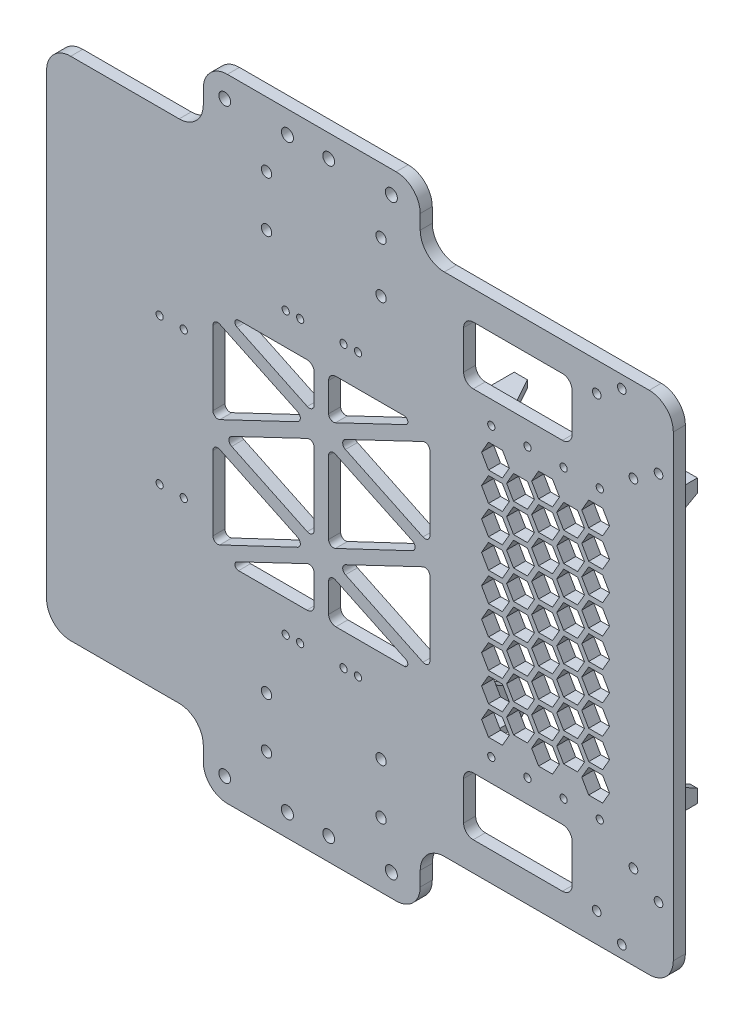
from build123d import *

# Parameters (mm, degrees)
EXTRUDE_1_DEPTH       = 5
EXTRUDE_2_DEPTH       = 20
CUT_EXTRUDE_3_DEPTH   = 10
CUT_EXTRUDE_4_DEPTH   = 10
MIRROR_2_COPY_1_DEPTH = 20
MIRROR_2_COPY_2_DEPTH = 10
MIRROR_2_COPY_3_DEPTH = 10
MIRROR_2_COPY_4_DEPTH = 20
MIRROR_2_COPY_5_DEPTH = 10
MIRROR_2_COPY_6_DEPTH = 10
CUT_EXTRUDE_5_DEPTH   = 5
SKETCH_9_W            = 45
SKETCH_9_H            = 24
CUT_EXTRUDE_6_DEPTH   = 5
FILLET_1_R            = 4
FILLET_2_R            = 1.5
FILLET_3_R            = 2
FILLET_4_R            = 3
SKETCH_10_R           = 1.8
SKETCH_10_R_2         = 2.5
SKETCH_10_R_3         = 2.45
SKETCH_10_R_4         = 1.5
SKETCH_10_R_5         = 2.15
CUT_EXTRUDE_7_DEPTH   = 186.636742053


with BuildPart() as part:
    # 草图1 → 凸台-拉伸1 (new body)
    with BuildSketch(Plane.XY):
        with BuildLine():
            Line((-130, 95), (-130, -95))
            ThreePointArc((-130, -95), (-127.071067812, -102.071067812), (-120, -105))
            Line((-120, -105), (-75, -105))
            ThreePointArc((-75, -105), (-67.928932188, -107.928932188), (-65, -115))
            Line((-65, -115), (-65, -121))
            ThreePointArc((-65, -121), (-62.071067812, -128.071067812), (-55, -131))
            Line((-55, -131), (15, -131))
            ThreePointArc((15, -131), (22.071067812, -128.071067812), (25, -121))
            Line((25, -121), (25, -115))
            ThreePointArc((25, -115), (27.928932188, -107.928932188), (35, -105))
            Line((35, -105), (120, -105))
            ThreePointArc((120, -105), (127.071067812, -102.071067812), (130, -95))
            Line((130, -95), (130, 95))
            ThreePointArc((130, 95), (127.071067812, 102.071067812), (120, 105))
            Line((120, 105), (35, 105))
            ThreePointArc((35, 105), (27.928932188, 107.928932188), (25, 115))
            Line((25, 115), (25, 121))
            ThreePointArc((25, 121), (22.071067812, 128.071067812), (15, 131))
            Line((15, 131), (-55, 131))
            ThreePointArc((-55, 131), (-62.071067812, 128.071067812), (-65, 121))
            Line((-65, 121), (-65, 115))
            ThreePointArc((-65, 115), (-67.928932188, 107.928932188), (-75, 105))
            Line((-75, 105), (-120, 105))
            ThreePointArc((-120, 105), (-127.071067812, 102.071067812), (-130, 95))
        make_face()
    extrude(amount=EXTRUDE_1_DEPTH)

    # 草图4 → 凸台-拉伸2 (add)
    with BuildSketch(Plane(origin=(0, 0, 0), x_dir=(-1, 0, 0), z_dir=(0, 0, -1))):
        Polygon((-39, -47.5), (-39, -58.5), (-50, -58.5), (-50, -55.5), (-42, -55.5), (-42, -47.5), align=None)
    extrude_2 = extrude(amount=EXTRUDE_2_DEPTH)

    # 草图5 → 切除-拉伸3 (cut)
    with BuildSketch(Plane.XZ.offset(58.5)):
        Polygon((50, -10), (44.5, -20), (50, -20), align=None)
    cut_extrude_3 = extrude(amount=-CUT_EXTRUDE_3_DEPTH, mode=Mode.SUBTRACT)

    # 草图6 → 切除-拉伸4 (cut)
    with BuildSketch(Plane.ZY.offset(-39)):
        Polygon((-20, -53), (-10, -47.5), (-20, -47.5), align=None)
    cut_extrude_4 = extrude(amount=-CUT_EXTRUDE_4_DEPTH, mode=Mode.SUBTRACT)

    # 镜向1: 凸台-拉伸2, 切除-拉伸3, 切除-拉伸4 across plane
    add(extrude_2.mirror(Plane(origin=(77, 0, 0), x_dir=(0, 0, 1), z_dir=(1, 0, 0))))
    add(cut_extrude_3.mirror(Plane(origin=(77, 0, 0), x_dir=(0, 0, 1), z_dir=(1, 0, 0))), mode=Mode.SUBTRACT)
    add(cut_extrude_4.mirror(Plane(origin=(77, 0, 0), x_dir=(0, 0, 1), z_dir=(1, 0, 0))), mode=Mode.SUBTRACT)

    # 镜向2 copy 1 sketch → 镜向2 copy 1 (add)
    with BuildSketch(Plane(origin=(154, 0, 0), x_dir=(1, 0, 0), z_dir=(0, 0, -1))):
        Polygon((-39, -47.5), (-39, -58.5), (-50, -58.5), (-50, -55.5), (-42, -55.5), (-42, -47.5), align=None)
    extrude(amount=MIRROR_2_COPY_1_DEPTH)

    # 镜向2 copy 2 sketch → 镜向2 copy 2 (cut)
    with BuildSketch(Plane(origin=(154, 58.5, 0), x_dir=(-1, 0, 0), z_dir=(0, 1, 0))):
        Polygon((50, -10), (44.5, -20), (50, -20), align=None)
    extrude(amount=-MIRROR_2_COPY_2_DEPTH, mode=Mode.SUBTRACT)

    # 镜向2 copy 3 sketch → 镜向2 copy 3 (cut)
    with BuildSketch(Plane(origin=(115, 0, 0), x_dir=(0, 0, 1), z_dir=(1, 0, 0))):
        Polygon((-20, -53), (-10, -47.5), (-20, -47.5), align=None)
    extrude(amount=-MIRROR_2_COPY_3_DEPTH, mode=Mode.SUBTRACT)

    # 镜向2 copy 4 sketch → 镜向2 copy 4 (add)
    with BuildSketch(Plane(origin=(0, 0, 0), x_dir=(-1, 0, 0), z_dir=(0, 0, -1))):
        Polygon((-39, 47.5), (-39, 58.5), (-50, 58.5), (-50, 55.5), (-42, 55.5), (-42, 47.5), align=None)
    extrude(amount=MIRROR_2_COPY_4_DEPTH)

    # 镜向2 copy 5 sketch → 镜向2 copy 5 (cut)
    with BuildSketch(Plane(origin=(0, 58.5, 0), x_dir=(1, 0, 0), z_dir=(0, 1, 0))):
        Polygon((50, 10), (44.5, 20), (50, 20), align=None)
    extrude(amount=-MIRROR_2_COPY_5_DEPTH, mode=Mode.SUBTRACT)

    # 镜向2 copy 6 sketch → 镜向2 copy 6 (cut)
    with BuildSketch(Plane.ZY.offset(-39)):
        Polygon((-20, 53), (-10, 47.5), (-20, 47.5), align=None)
    extrude(amount=-MIRROR_2_COPY_6_DEPTH, mode=Mode.SUBTRACT)

    # 草图7 → 切除-拉伸5 (cut)
    with BuildSketch(Plane(origin=(0, 0, 0), x_dir=(-1, 0, 0), z_dir=(0, 0, -1))):
        Polygon((-92.012994616, 36), (-94.899745962, 41), (-100.673248654, 41), (-103.56, 36), (-100.673248654, 31), (-94.899745962, 31), align=None)
        Polygon((-74.115136271, 31), (-71.228384925, 36), (-74.115136271, 41), (-79.888638963, 41), (-82.775390309, 36), (-79.888638963, 31), align=None)
        Polygon((-92.012994616, 24), (-94.899745962, 29), (-100.673248654, 29), (-103.56, 24), (-100.673248654, 19), (-94.899745962, 19), align=None)
        Polygon((-93.167695155, 30), (-90.280943809, 25), (-84.507441117, 25), (-81.620689771, 30), (-84.507441117, 35), (-90.280943809, 35), align=None)
        Polygon((-84.507441117, 37), (-81.620689771, 42), (-84.507441117, 47), (-90.280943809, 47), (-93.167695155, 42), (-90.280943809, 37), align=None)
        Polygon((-79.888638963, 43), (-74.115136271, 43), (-71.228384925, 48), (-74.115136271, 53), (-79.888638963, 53), (-82.775390309, 48), align=None)
        Polygon((-94.899745962, 43), (-92.012994616, 48), (-94.899745962, 53), (-100.673248654, 53), (-103.56, 48), (-100.673248654, 43), align=None)
        Polygon((-72.383085464, 42), (-69.496334118, 37), (-63.722831426, 37), (-60.83608008, 42), (-63.722831426, 47), (-69.496334118, 47), align=None)
        Polygon((-93.167695155, 18), (-90.280943809, 13), (-84.507441117, 13), (-81.620689771, 18), (-84.507441117, 23), (-90.280943809, 23), align=None)
        Polygon((-74.115136271, 19), (-71.228384925, 24), (-74.115136271, 29), (-79.888638963, 29), (-82.775390309, 24), (-79.888638963, 19), align=None)
        Polygon((-72.383085464, 30), (-69.496334118, 25), (-63.722831426, 25), (-60.83608008, 30), (-63.722831426, 35), (-69.496334118, 35), align=None)
        Polygon((-92.012994616, 12), (-94.899745962, 17), (-100.673248654, 17), (-103.56, 12), (-100.673248654, 7), (-94.899745962, 7), align=None)
        Polygon((-93.167695155, 6), (-90.280943809, 1), (-84.507441117, 1), (-81.620689771, 6), (-84.507441117, 11), (-90.280943809, 11), align=None)
        Polygon((-74.115136271, 7), (-71.228384925, 12), (-74.115136271, 17), (-79.888638963, 17), (-82.775390309, 12), (-79.888638963, 7), align=None)
        Polygon((-72.383085464, 18), (-69.496334118, 13), (-63.722831426, 13), (-60.83608008, 18), (-63.722831426, 23), (-69.496334118, 23), align=None)
        Polygon((-92.012994616, 0), (-94.899745962, 5), (-100.673248654, 5), (-103.56, 0), (-100.673248654, -5), (-94.899745962, -5), align=None)
        Polygon((-93.167695155, -6), (-90.280943809, -11), (-84.507441117, -11), (-81.620689771, -6), (-84.507441117, -1), (-90.280943809, -1), align=None)
        Polygon((-74.115136271, -5), (-71.228384925, 0), (-74.115136271, 5), (-79.888638963, 5), (-82.775390309, 0), (-79.888638963, -5), align=None)
        Polygon((-72.383085464, 6), (-69.496334118, 1), (-63.722831426, 1), (-60.83608008, 6), (-63.722831426, 11), (-69.496334118, 11), align=None)
        Polygon((-92.012994616, -12), (-94.899745962, -7), (-100.673248654, -7), (-103.56, -12), (-100.673248654, -17), (-94.899745962, -17), align=None)
        Polygon((-93.167695155, -18), (-90.280943809, -23), (-84.507441117, -23), (-81.620689771, -18), (-84.507441117, -13), (-90.280943809, -13), align=None)
        Polygon((-74.115136271, -17), (-71.228384925, -12), (-74.115136271, -7), (-79.888638963, -7), (-82.775390309, -12), (-79.888638963, -17), align=None)
        Polygon((-72.383085464, -6), (-69.496334118, -11), (-63.722831426, -11), (-60.83608008, -6), (-63.722831426, -1), (-69.496334118, -1), align=None)
        Polygon((-92.012994616, -24), (-94.899745962, -19), (-100.673248654, -19), (-103.56, -24), (-100.673248654, -29), (-94.899745962, -29), align=None)
        Polygon((-93.167695155, -30), (-90.280943809, -35), (-84.507441117, -35), (-81.620689771, -30), (-84.507441117, -25), (-90.280943809, -25), align=None)
        Polygon((-74.115136271, -29), (-71.228384925, -24), (-74.115136271, -19), (-79.888638963, -19), (-82.775390309, -24), (-79.888638963, -29), align=None)
        Polygon((-72.383085464, -18), (-69.496334118, -23), (-63.722831426, -23), (-60.83608008, -18), (-63.722831426, -13), (-69.496334118, -13), align=None)
        Polygon((-92.012994616, -36), (-94.899745962, -31), (-100.673248654, -31), (-103.56, -36), (-100.673248654, -41), (-94.899745962, -41), align=None)
        Polygon((-93.167695155, -42), (-90.280943809, -47), (-84.507441117, -47), (-81.620689771, -42), (-84.507441117, -37), (-90.280943809, -37), align=None)
        Polygon((-74.115136271, -41), (-71.228384925, -36), (-74.115136271, -31), (-79.888638963, -31), (-82.775390309, -36), (-79.888638963, -41), align=None)
        Polygon((-72.383085464, -30), (-69.496334118, -35), (-63.722831426, -35), (-60.83608008, -30), (-63.722831426, -25), (-69.496334118, -25), align=None)
        Polygon((-92.012994616, -48), (-94.899745962, -43), (-100.673248654, -43), (-103.56, -48), (-100.673248654, -53), (-94.899745962, -53), align=None)
        Polygon((-74.115136271, -53), (-71.228384925, -48), (-74.115136271, -43), (-79.888638963, -43), (-82.775390309, -48), (-79.888638963, -53), align=None)
        Polygon((-72.383085464, -42), (-69.496334118, -47), (-63.722831426, -47), (-60.83608008, -42), (-63.722831426, -37), (-69.496334118, -37), align=None)
        Polygon((-61.990780618, 36), (-59.104029272, 31), (-53.330526581, 31), (-50.443775235, 36), (-53.330526581, 41), (-59.104029272, 41), align=None)
        Polygon((-61.990780618, 48), (-59.104029272, 43), (-53.330526581, 43), (-50.443775235, 48), (-53.330526581, 53), (-59.104029272, 53), align=None)
        Polygon((-61.990780618, 24), (-59.104029272, 19), (-53.330526581, 19), (-50.443775235, 24), (-53.330526581, 29), (-59.104029272, 29), align=None)
        Polygon((-61.990780618, 12), (-59.104029272, 7), (-53.330526581, 7), (-50.443775235, 12), (-53.330526581, 17), (-59.104029272, 17), align=None)
        Polygon((-61.990780618, 0), (-59.104029272, -5), (-53.330526581, -5), (-50.443775235, 0), (-53.330526581, 5), (-59.104029272, 5), align=None)
        Polygon((-61.990780618, -12), (-59.104029272, -17), (-53.330526581, -17), (-50.443775235, -12), (-53.330526581, -7), (-59.104029272, -7), align=None)
        Polygon((-61.990780618, -24), (-59.104029272, -29), (-53.330526581, -29), (-50.443775235, -24), (-53.330526581, -19), (-59.104029272, -19), align=None)
        Polygon((-61.990780618, -36), (-59.104029272, -41), (-53.330526581, -41), (-50.443775235, -36), (-53.330526581, -31), (-59.104029272, -31), align=None)
        Polygon((-61.990780618, -48), (-59.104029272, -53), (-53.330526581, -53), (-50.443775235, -48), (-53.330526581, -43), (-59.104029272, -43), align=None)
    extrude(amount=-CUT_EXTRUDE_5_DEPTH, mode=Mode.SUBTRACT)

    # 草图9 → 切除-拉伸6 (cut)
    with BuildSketch(Plane(origin=(0, 0, 0), x_dir=(-1, 0, 0), z_dir=(0, 0, -1))):
        Polygon((9.804878049, 22.5), (-29, 41), (-29, 4), align=None)
        Polygon((13, -26.88372093), (-25, -45), (13, -45), align=None)
        Polygon((22.074593576, -22.557461202), (61, -41), (61, -4), align=None)
        Polygon((19, 26.88372093), (57, 45), (19, 45), align=None)
        Polygon((19, -18.11627907), (57, 0), (19, 18.11627907), align=None)
        with Locations((-65.5, 81)):
            Rectangle(SKETCH_9_W, SKETCH_9_H)
        with Locations((-65.5, -81)):
            Rectangle(SKETCH_9_W, SKETCH_9_H)
        Polygon((13, 45), (-25, 45), (13, 26.88372093), align=None)
        Polygon((61, 4), (61, 41), (22.074593576, 22.557461202), align=None)
        Polygon((13, 18.257993079), (-25.535898385, 0), (13, -18.257993079), align=None)
        Polygon((19, -45), (57, -45), (19, -26.88372093), align=None)
        Polygon((-29, -41), (9.804878049, -22.5), (-29, -4), align=None)
    extrude(amount=-CUT_EXTRUDE_6_DEPTH, mode=Mode.SUBTRACT)

    # 圆角1
    fillet_1_edges = [part.edges().sort_by_distance(p)[0] for p in [
        (43, -93, 2.5),
        (88, -69, 2.5),
        (43, -69, 2.5),
        (88, -93, 2.5),
        (88, 69, 2.5),
        (43, 69, 2.5),
        (43, 93, 2.5),
        (88, 93, 2.5),
    ]]
    fillet(fillet_1_edges, radius=FILLET_1_R)

    # 圆角2
    fillet_2_edges = [part.edges().sort_by_distance(p)[0] for p in [
        (25, -45, 2.5),
        (-57, -45, 2.5),
        (25, 45, 2.5),
        (-57, 45, 2.5),
    ]]
    fillet(fillet_2_edges, radius=FILLET_2_R)

    # 圆角3
    fillet_3_edges = [part.edges().sort_by_distance(p)[0] for p in [
        (29, -4, 2.5),
        (29, 4, 2.5),
        (-13, -18.257993079, 2.5),
        (-61, -41, 2.5),
        (-61, 4, 2.5),
        (-13, -26.88372093, 2.5),
        (-13, 18.257993079, 2.5),
        (-61, -4, 2.5),
        (-22.074593576, -22.557461202, 2.5),
        (25.535898385, 0, 2.5),
        (-22.074593576, 22.557461202, 2.5),
        (-61, 41, 2.5),
        (-19, 26.88372093, 2.5),
        (-19, -26.88372093, 2.5),
        (-19, -18.11627907, 2.5),
        (29, -41, 2.5),
        (29, 41, 2.5),
        (-57, 0, 2.5),
        (-9.804878049, -22.5, 2.5),
        (-13, 26.88372093, 2.5),
        (-9.804878049, 22.5, 2.5),
        (-19, 18.11627907, 2.5),
    ]]
    fillet(fillet_3_edges, radius=FILLET_3_R)

    # 圆角4
    fillet_4_edges = [part.edges().sort_by_distance(p)[0] for p in [
        (-13, -45, 2.5),
        (-13, 45, 2.5),
        (-19, -45, 2.5),
        (-19, 45, 2.5),
    ]]
    fillet(fillet_4_edges, radius=FILLET_4_R)

    # 草图10 → 切除-拉伸7 (cut, through all)
    with BuildSketch(Plane(origin=(0, 0, 0), x_dir=(-1, 0, 0), z_dir=(0, 0, -1))):
        with Locations((-123.874270778, 76.959685144)):
            Circle(SKETCH_10_R)
        with Locations((-113.46869275, 70.033362462)):
            Circle(SKETCH_10_R)
        with Locations((-108.636360878, 99.851956806)):
            Circle(SKETCH_10_R)
        with Locations((-98.23078285, 92.925634125)):
            Circle(SKETCH_10_R)
        with Locations((-13.026746603, 121.678975654)):
            Circle(SKETCH_10_R_2)
        with Locations((56.094087389, 121.678975654)):
            Circle(SKETCH_10_R_3)
        with Locations((30.094087389, 121.678975654)):
            Circle(SKETCH_10_R_2)
        with Locations((12.973253397, 121.678975654)):
            Circle(SKETCH_10_R_3)
        with Locations((12.973253397, -121.678975654)):
            Circle(SKETCH_10_R_3)
        with Locations((30.094087389, -121.678975654)):
            Circle(SKETCH_10_R_2)
        with Locations((56.094087389, -121.678975654)):
            Circle(SKETCH_10_R_3)
        with Locations((-13.026746603, -121.678975654)):
            Circle(SKETCH_10_R_2)
        with Locations((-98.23078285, -92.925634125)):
            Circle(SKETCH_10_R)
        with Locations((-108.636360878, -99.851956806)):
            Circle(SKETCH_10_R)
        with Locations((-113.46869275, -70.033362462)):
            Circle(SKETCH_10_R)
        with Locations((-123.874270778, -76.959685144)):
            Circle(SKETCH_10_R)
        with Locations((-99.5, 59.5)):
            Circle(SKETCH_10_R_4)
        with Locations((-84.5, 59.5)):
            Circle(SKETCH_10_R_4)
        with Locations((-69.5, 59.5)):
            Circle(SKETCH_10_R_4)
        with Locations((-54.5, 59.5)):
            Circle(SKETCH_10_R_4)
        with Locations((0.806057342, 58.25)):
            Circle(SKETCH_10_R_4)
        with Locations((6.806057342, 58.25)):
            Circle(SKETCH_10_R_4)
        with Locations((24.806057342, 58.25)):
            Circle(SKETCH_10_R_4)
        with Locations((30.806057342, 58.25)):
            Circle(SKETCH_10_R_4)
        with Locations((30.806057342, -58.25)):
            Circle(SKETCH_10_R_4)
        with Locations((24.806057342, -58.25)):
            Circle(SKETCH_10_R_4)
        with Locations((6.806057342, -58.25)):
            Circle(SKETCH_10_R_4)
        with Locations((0.806057342, -58.25)):
            Circle(SKETCH_10_R_4)
        with Locations((-54.5, -59.5)):
            Circle(SKETCH_10_R_4)
        with Locations((-69.5, -59.5)):
            Circle(SKETCH_10_R_4)
        with Locations((-84.5, -59.5)):
            Circle(SKETCH_10_R_4)
        with Locations((-99.5, -59.5)):
            Circle(SKETCH_10_R_4)
        with Locations((-8.75, 83.16647484)):
            Circle(SKETCH_10_R_5)
        with Locations((38.75, 83.16647484)):
            Circle(SKETCH_10_R_5)
        with Locations((38.75, 104.16647484)):
            Circle(SKETCH_10_R_5)
        with Locations((-8.75, 104.16647484)):
            Circle(SKETCH_10_R_5)
        with Locations((-8.75, -104.16647484)):
            Circle(SKETCH_10_R_5)
        with Locations((38.75, -104.16647484)):
            Circle(SKETCH_10_R_5)
        with Locations((38.75, -83.16647484)):
            Circle(SKETCH_10_R_5)
        with Locations((-8.75, -83.16647484)):
            Circle(SKETCH_10_R_5)
        with Locations((73.101514825, 30.3)):
            Circle(SKETCH_10_R_4)
        with Locations((83.101514825, 30.3)):
            Circle(SKETCH_10_R_4)
        with Locations((83.101514825, -30.3)):
            Circle(SKETCH_10_R_4)
        with Locations((73.101514825, -30.3)):
            Circle(SKETCH_10_R_4)
    extrude(amount=-CUT_EXTRUDE_7_DEPTH, mode=Mode.SUBTRACT)


solid = part.part
